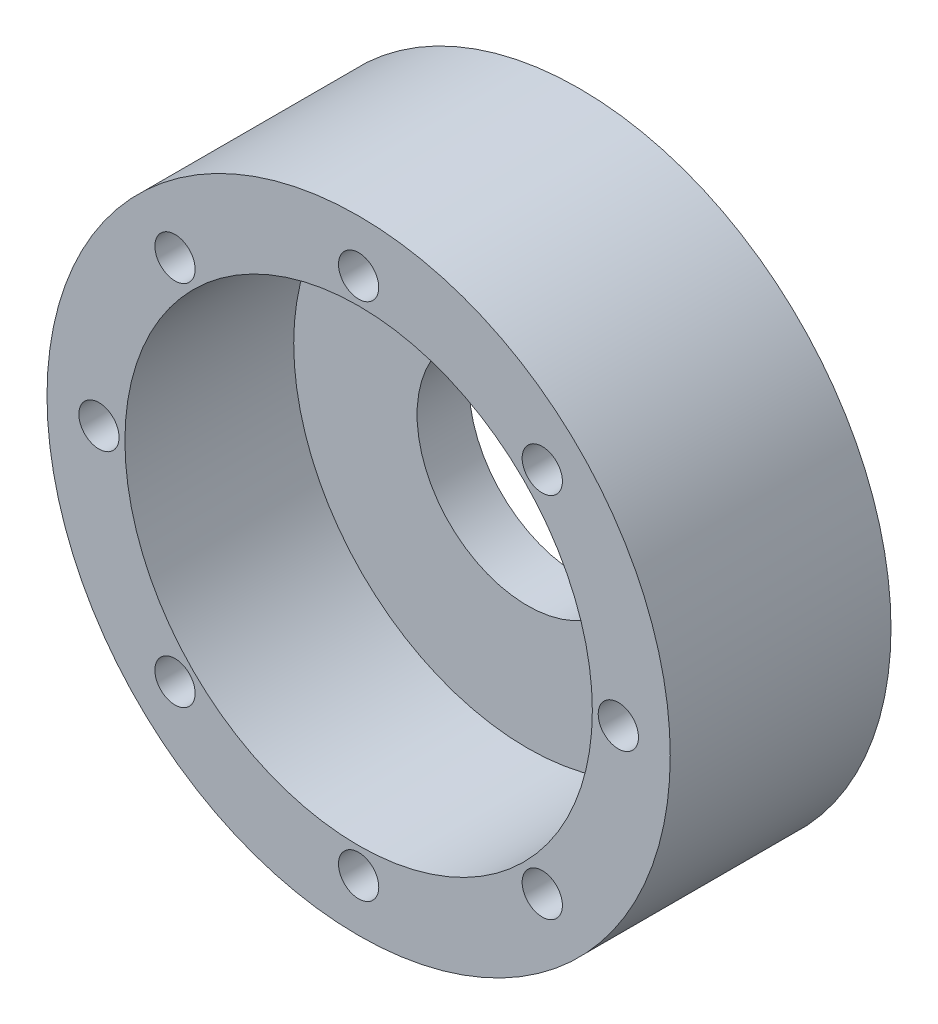
from build123d import *

# Parameters (mm, degrees)
SKETCH6_R           = 24
SKETCH6_R_2         = 1.55
SKETCH6_R_3         = 8.5
BOSS_EXTRUDE1_DEPTH = 17
SKETCH8_R           = 3.5
CUT_EXTRUDE6_DEPTH  = 3
SKETCH9_R           = 18
CUT_EXTRUDE7_DEPTH  = 13


with BuildPart() as part:
    # Sketch6 → Boss-Extrude1 (new body)
    with BuildSketch(Plane.XY):
        Circle(SKETCH6_R)
        with Locations((0, 20)):
            Circle(SKETCH6_R_2, mode=Mode.SUBTRACT)
        with Locations((14.142135624, 14.142135624)):
            Circle(SKETCH6_R_2, mode=Mode.SUBTRACT)
        with Locations((20, 0)):
            Circle(SKETCH6_R_2, mode=Mode.SUBTRACT)
        with Locations((14.142135624, -14.142135624)):
            Circle(SKETCH6_R_2, mode=Mode.SUBTRACT)
        with Locations((0, -20)):
            Circle(SKETCH6_R_2, mode=Mode.SUBTRACT)
        with Locations((-14.142135624, -14.142135624)):
            Circle(SKETCH6_R_2, mode=Mode.SUBTRACT)
        with Locations((-20, 0)):
            Circle(SKETCH6_R_2, mode=Mode.SUBTRACT)
        with Locations((-14.142135624, 14.142135624)):
            Circle(SKETCH6_R_2, mode=Mode.SUBTRACT)
        Circle(SKETCH6_R_3, mode=Mode.SUBTRACT)
    extrude(amount=BOSS_EXTRUDE1_DEPTH)

    # Sketch8 → Cut-Extrude6 (cut)
    with BuildSketch(Plane(origin=(0, 0, 0), x_dir=(-1, 0, 0), z_dir=(0, 0, -1))):
        with Locations((0, 20)):
            Circle(SKETCH8_R)
        with Locations((14.142135624, 14.142135624)):
            Circle(SKETCH8_R)
        with Locations((20, 0)):
            Circle(SKETCH8_R)
        with Locations((14.142135624, -14.142135624)):
            Circle(SKETCH8_R)
        with Locations((0, -20)):
            Circle(SKETCH8_R)
        with Locations((-14.142135624, -14.142135624)):
            Circle(SKETCH8_R)
        with Locations((-20, 0)):
            Circle(SKETCH8_R)
        with Locations((-14.142135624, 14.142135624)):
            Circle(SKETCH8_R)
    extrude(amount=-CUT_EXTRUDE6_DEPTH, mode=Mode.SUBTRACT)

    # Sketch9 → Cut-Extrude7 (cut)
    with BuildSketch(Plane.XY.offset(17)):
        Circle(SKETCH9_R)
    extrude(amount=-CUT_EXTRUDE7_DEPTH, mode=Mode.SUBTRACT)


solid = part.part
